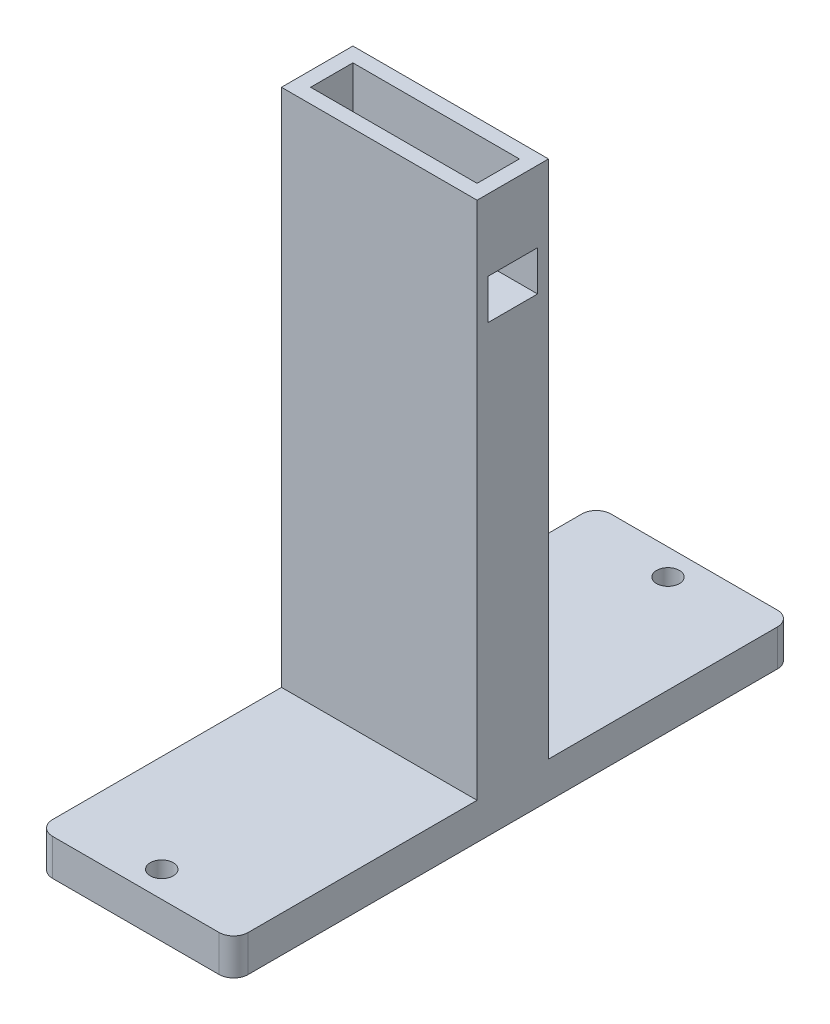
from build123d import *

# Parameters (mm, degrees)
SKETCH1_R             = 2
BOSS_EXTRUDE1_DEPTH   = 6.35
BOSS_EXTRUDE1_2_DEPTH = 6.35
SKETCH1_3_W           = 34.08
SKETCH1_3_H           = 12.446
BOSS_EXTRUDE2_DEPTH   = 77.5
SKETCH2_W             = 34.08
SKETCH2_H             = 12.446
SKETCH2_W_2           = 29
SKETCH2_H_2           = 7.366
BOSS_EXTRUDE3_DEPTH   = 19.4
SKETCH3_W             = 8.636
SKETCH3_H             = 6.985
CUT_EXTRUDE1_DEPTH    = 13.97
SKETCH4_W             = 5
SKETCH4_H             = 7.366
BOSS_EXTRUDE4_DEPTH   = 3.2


with BuildPart() as part:
    # Sketch1 → Boss-Extrude1 (new body)
    with BuildSketch(Plane(origin=(0, 0, 0), x_dir=(1, 0, 0), z_dir=(0, 1, 0))):
        with BuildLine():
            Line((-17.04, 6.223), (17.04, 6.223))
            Line((17.04, 6.223), (17.04, 46.101))
            ThreePointArc((17.04, 46.101), (16.296051224, 47.897051224), (14.5, 48.641))
            Line((14.5, 48.641), (-14.5, 48.641))
            ThreePointArc((-14.5, 48.641), (-16.296051224, 47.897051224), (-17.04, 46.101))
            Line((-17.04, 46.101), (-17.04, 6.223))
        make_face()
        with Locations((-0.022, 44.101004)):
            Circle(SKETCH1_R, mode=Mode.SUBTRACT)
    extrude(amount=BOSS_EXTRUDE1_DEPTH)



with BuildPart() as body_2:
    # Sketch1 → Boss-Extrude1 2 (new body)
    with BuildSketch(Plane(origin=(0, 0, 0), x_dir=(1, 0, 0), z_dir=(0, 1, 0))):
        with BuildLine():
            Line((17.04, -46.101), (17.04, -6.223))
            Line((17.04, -6.223), (-17.04, -6.223))
            Line((-17.04, -6.223), (-17.04, -46.101))
            ThreePointArc((-17.04, -46.101), (-16.296051224, -47.897051224), (-14.5, -48.641))
            Line((-14.5, -48.641), (14.5, -48.641))
            ThreePointArc((14.5, -48.641), (16.296051224, -47.897051224), (17.04, -46.101))
        make_face()
        with Locations((-0.022, -44.101004)):
            Circle(SKETCH1_R, mode=Mode.SUBTRACT)
    extrude(amount=BOSS_EXTRUDE1_2_DEPTH)


with BuildPart() as part_1:
    add(part.part)

    add(body_2.part)  # Boss-Extrude2 merges body 2
    # Sketch1<3> → Boss-Extrude2 (add)
    with BuildSketch(Plane(origin=(0, 0, 0), x_dir=(1, 0, 0), z_dir=(0, 1, 0))):
        Rectangle(SKETCH1_3_W, SKETCH1_3_H)
    extrude(amount=BOSS_EXTRUDE2_DEPTH)

    # Sketch2 → Boss-Extrude3 (add)
    with BuildSketch(Plane(origin=(0, 77.5, 0), x_dir=(1, 0, 0), z_dir=(0, 1, 0))):
        Rectangle(SKETCH2_W, SKETCH2_H)
        Rectangle(SKETCH2_W_2, SKETCH2_H_2, mode=Mode.SUBTRACT)
    extrude(amount=BOSS_EXTRUDE3_DEPTH)

    # Sketch3 → Cut-Extrude1 (cut)
    with BuildSketch(Plane(origin=(17.04, 0, 0), x_dir=(0, 0, -1), z_dir=(1, 0, 0))):
        with Locations((0, 80.9705)):
            Rectangle(SKETCH3_W, SKETCH3_H)
    extrude(amount=-CUT_EXTRUDE1_DEPTH, mode=Mode.SUBTRACT)

    # Sketch4 → Boss-Extrude4 (add)
    with BuildSketch(Plane(origin=(0, 77.5, 0), x_dir=(1, 0, 0), z_dir=(0, 1, 0))):
        with Locations((-12, 0)):
            Rectangle(SKETCH4_W, SKETCH4_H)
    extrude(amount=BOSS_EXTRUDE4_DEPTH)


solid = part_1.part
